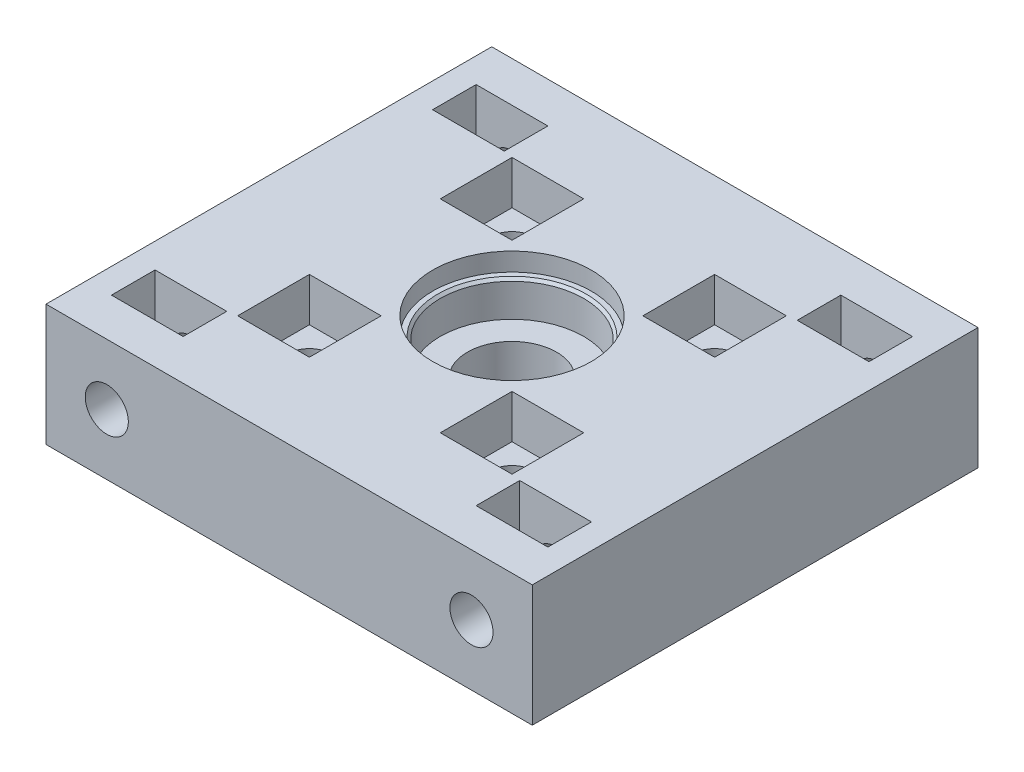
from build123d import *

# Parameters (mm, degrees)
SKETCH1_W               = 76.2
SKETCH1_H               = 69.85
BOSS_EXTRUDE1_DEPTH     = 9.525
F_1_4_CLEARANCE_HOLE1_D = 6.7564
SKETCH5_W               = 11.2395
SKETCH5_H               = 11.2395
CUT_EXTRUDE1_DEPTH      = 6.8326
F_3_8_CLEARANCE_HOLE1_D = 13.97
CUT_EXTRUDE2_START      = -6.35
CUT_EXTRUDE2_DEPTH      = 6.8326
MIRROR2_START           = -6.35
MIRROR2_COPY_2_DEPTH    = 6.8326


with BuildPart() as part:
    # Sketch1 → Boss-Extrude1 (new, symmetric)
    with BuildSketch(Plane(origin=(0, 0, 0), x_dir=(1, 0, 0), z_dir=(0, 1, 0))):
        Rectangle(SKETCH1_W, SKETCH1_H)
    extrude(amount=BOSS_EXTRUDE1_DEPTH, both=True)

    # 1/4 Clearance Hole1 (through all)
    with Locations(Plane(origin=(0, 9.525, 0), x_dir=(1, 0, 0), z_dir=(0, 1, 0))):
        with Locations((-15.875, 15.875)):
            f_1_4_clearance_hole1 = Hole(F_1_4_CLEARANCE_HOLE1_D / 2)

    # Sketch5 → Cut-Extrude1 (cut)
    with BuildSketch(Plane(origin=(0, 9.525, 0), x_dir=(1, 0, 0), z_dir=(0, 1, 0))):
        with Locations((-15.875, 15.875)):
            Rectangle(SKETCH5_W, SKETCH5_H)
    cut_extrude1 = extrude(amount=-CUT_EXTRUDE1_DEPTH, mode=Mode.SUBTRACT)

    # Sketch-Pattern1: 1/4 Clearance Hole1, Cut-Extrude1 at 3 more places
    with Locations((31.75, 0, 0), (31.75, 0, 31.75), (0, 0, 31.75)):
        add(f_1_4_clearance_hole1, mode=Mode.SUBTRACT)
        add(cut_extrude1, mode=Mode.SUBTRACT)

    # 3/8 Clearance Hole1 (through all)
    with Locations(Plane(origin=(0, 9.525, 0), x_dir=(1, 0, 0), z_dir=(0, 1, 0))):
        with Locations((0, 0)):
            Hole(F_3_8_CLEARANCE_HOLE1_D / 2)


with BuildPart() as body_2:
    # uxcell-FR6ZZ: read off the stored shape, not the designer's step
    # uxcell-FR6ZZ outline → uxcell-FR6ZZ (revolve)
    with BuildSketch(Plane(origin=(-26.978230937, 0, 2.629647059), x_dir=(1, 0, 0), z_dir=(0, 0, 1))):
        Polygon((12.430125, 16.66875), (4.7625, 16.66875), (4.7625, 8.255), (11.2395, 8.255), (11.2395, 13.414375), (11.636375, 13.81125), (12.430125, 13.81125), align=None)
    revolve(axis=Axis((-26.978230937, 0, 2.629647059), (0, 1, 0)))


with BuildPart() as body_2_1:
    # Body-Move/Copy2: read off the stored shape, not the designer's step
    # Body-Move/Copy2: moved
    add(body_2.part.moved(Location((26.9782309, -7.14375, -2.6296471))))


with BuildPart() as part_1:
    add(part.part)

    # Combine1: cut body 2
    add(body_2_1.part, mode=Mode.SUBTRACT)

    # Sketch11 → 1/4 Clearance Hole2 (revolve, cut)
    with BuildSketch(Plane(origin=(-28.575, 0, 34.925), x_dir=(0, -1, 0), z_dir=(1, 0, 0))):
        Polygon((0, 0), (0, 27.429827343), (3.3782, 25.4), (3.3782, 0), align=None)
    f_1_4_clearance_hole2 = revolve(axis=Axis((-28.575, 0, 41.275), (0, 0, -1)), mode=Mode.SUBTRACT)

    # Sketch13 → Cut-Extrude2 (cut)
    with BuildSketch(Plane.XY.offset(34.925).offset(CUT_EXTRUDE2_START)):
        Polygon((-34.19475, 5.61975), (-34.19475, 9.525), (-22.95525, 9.525), (-22.95525, 5.61975), (-22.95525, -5.61975), (-34.19475, -5.61975), align=None)
    cut_extrude2 = extrude(amount=-CUT_EXTRUDE2_DEPTH, mode=Mode.SUBTRACT)

    # Mirror1: 1/4 Clearance Hole2, Cut-Extrude2 across plane
    add(f_1_4_clearance_hole2.mirror(Plane(origin=(0, 0, 0), x_dir=(0, 0, 1), z_dir=(1, 0, 0))), mode=Mode.SUBTRACT)
    add(cut_extrude2.mirror(Plane(origin=(0, 0, 0), x_dir=(0, 0, 1), z_dir=(1, 0, 0))), mode=Mode.SUBTRACT)

    # Mirror2: 1/4 Clearance Hole2, Cut-Extrude2 across plane
    add(f_1_4_clearance_hole2.mirror(Plane.XY), mode=Mode.SUBTRACT)
    add(cut_extrude2.mirror(Plane.XY), mode=Mode.SUBTRACT)

    # Mirror2 copy 1 sketch → Mirror2 copy 1 (revolve, cut)
    with BuildSketch(Plane(origin=(28.575, 0, -34.925), x_dir=(0, -1, 0), z_dir=(-1, 0, 0))):
        Polygon((0, 0), (0, 27.429827343), (3.3782, 25.4), (3.3782, 0), align=None)
    revolve(axis=Axis((28.575, 0, -41.275), (0, 0, 1)), mode=Mode.SUBTRACT)

    # Mirror2 copy 2 sketch → Mirror2 copy 2 (cut)
    with BuildSketch(Plane(origin=(0, 0, -34.925), x_dir=(-1, 0, 0), z_dir=(0, 0, -1)).offset(MIRROR2_START)):
        Polygon((-34.19475, 5.61975), (-34.19475, 9.525), (-22.95525, 9.525), (-22.95525, 5.61975), (-22.95525, -5.61975), (-34.19475, -5.61975), align=None)
    extrude(amount=-MIRROR2_COPY_2_DEPTH, mode=Mode.SUBTRACT)


solid = part_1.part
